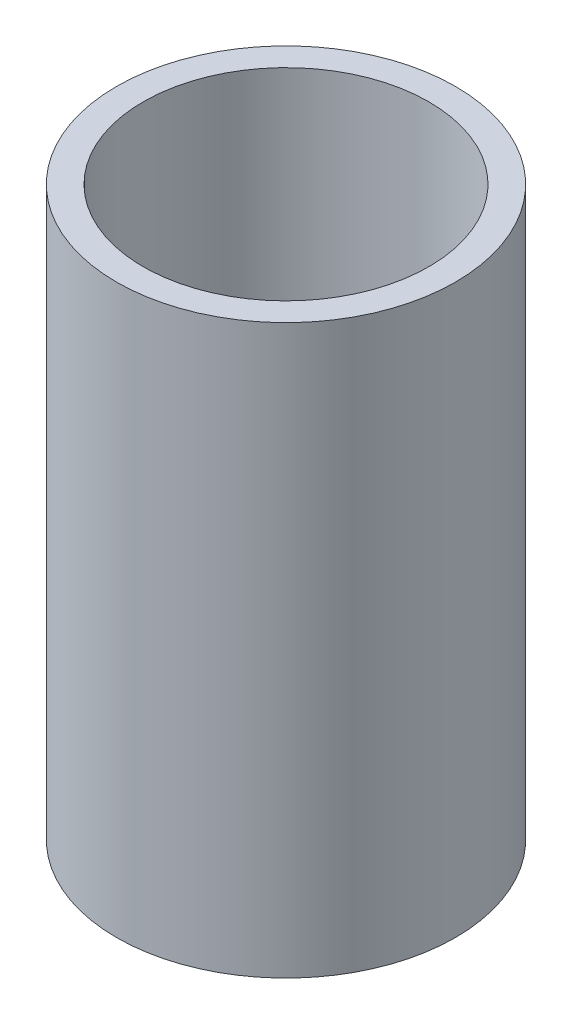
from build123d import *

# Parameters (mm, degrees)
SKETCH1_R           = 25
BOSS_EXTRUDE1_DEPTH = 83.734914298
SKETCH2_R           = 21.071828667
CUT_EXTRUDE1_DEPTH  = 91.892991328


with BuildPart() as part:
    # Sketch1 → Boss-Extrude1 (new body)
    with BuildSketch(Plane(origin=(0, 0, 0), x_dir=(1, 0, 0), z_dir=(0, 1, 0))):
        Circle(SKETCH1_R)
    extrude(amount=BOSS_EXTRUDE1_DEPTH)

    # Sketch2 → Cut-Extrude1 (cut, through all)
    with BuildSketch(Plane(origin=(0, 0, 0), x_dir=(1, 0, 0), z_dir=(0, 1, 0))):
        Circle(SKETCH2_R)
    extrude(amount=CUT_EXTRUDE1_DEPTH, mode=Mode.SUBTRACT)


solid = part.part
